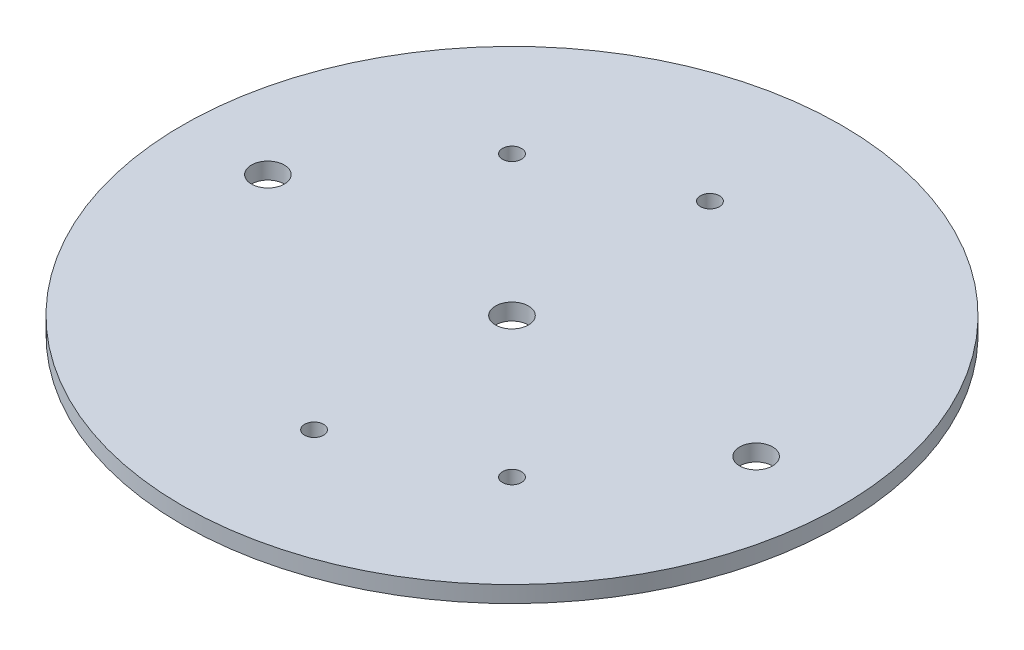
from build123d import *

# Parameters (mm, degrees)
SKETCH2_R           = 63.4365
SKETCH2_R_2         = 3.175
SKETCH2_R_3         = 1.8288
BOSS_EXTRUDE1_DEPTH = 3.175


with BuildPart() as part:
    # Sketch2 → Boss-Extrude1 (new body)
    with BuildSketch(Plane(origin=(0, 0, 0), x_dir=(1, 0, 0), z_dir=(0, 1, 0))):
        Circle(SKETCH2_R)
        with Locations((-46.99, 0)):
            Circle(SKETCH2_R_2, mode=Mode.SUBTRACT)
        with Locations((46.99, 0)):
            Circle(SKETCH2_R_2, mode=Mode.SUBTRACT)
        Circle(SKETCH2_R_2, mode=Mode.SUBTRACT)
        with Locations((0, 38.1)):
            Circle(SKETCH2_R_3, mode=Mode.SUBTRACT)
        with Locations((0, -38.1)):
            Circle(SKETCH2_R_3, mode=Mode.SUBTRACT)
        with Locations((-26.940768363, 26.940768363)):
            Circle(SKETCH2_R_3, mode=Mode.SUBTRACT)
        with Locations((26.940768363, -26.940768363)):
            Circle(SKETCH2_R_3, mode=Mode.SUBTRACT)
    extrude(amount=BOSS_EXTRUDE1_DEPTH)


solid = part.part
